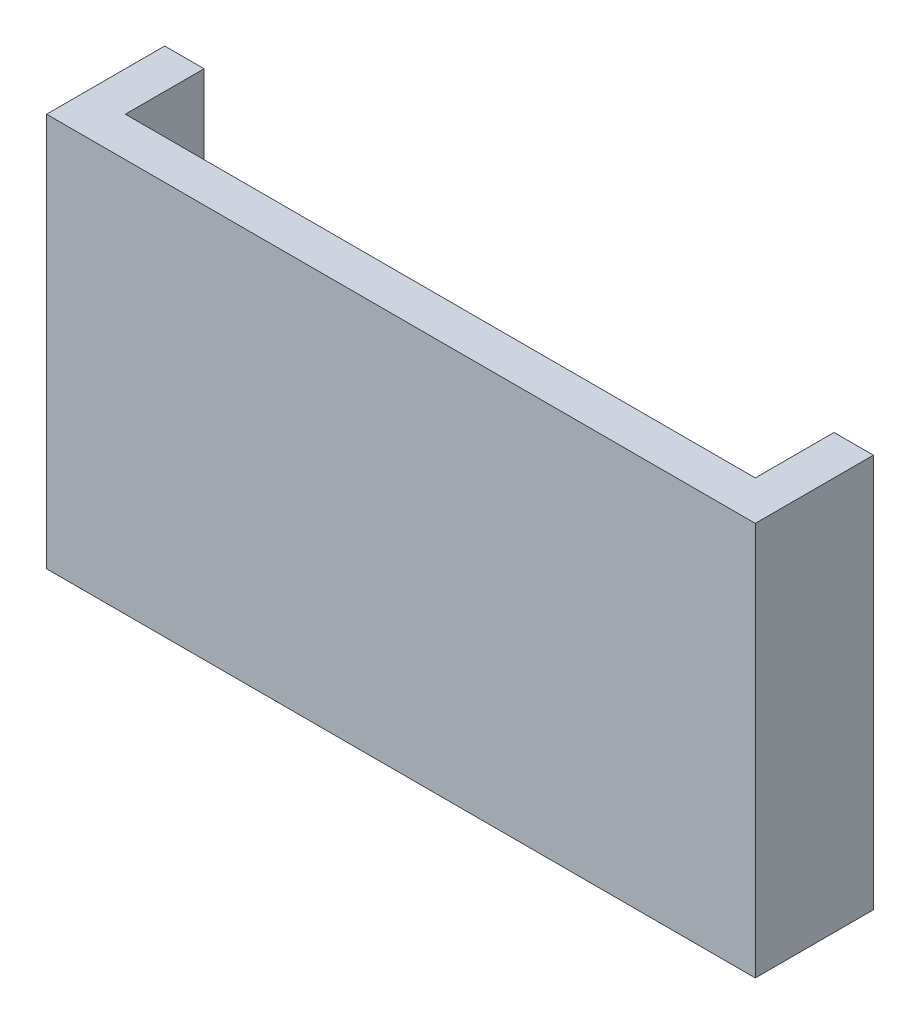
from build123d import *

# Parameters (mm, degrees)
SKETCH1_W           = 15
SKETCH1_H           = 1
BOSS_EXTRUDE1_DEPTH = 7
BOSS_EXTRUDE2_DEPTH = 1
BOSS_EXTRUDE4_DEPTH = 10


with BuildPart() as part:
    # Sketch1 → Boss-Extrude1 (new body)
    with BuildSketch(Plane(origin=(0, 0, 0), x_dir=(1, 0, 0), z_dir=(0, 1, 0))):
        with Locations((-9.5, 2.5)):
            Rectangle(SKETCH1_W, SKETCH1_H)
    extrude(amount=BOSS_EXTRUDE1_DEPTH)

    # Sketch1<3> → Boss-Extrude2 (add)
    with BuildSketch(Plane(origin=(0, 0, 0), x_dir=(1, 0, 0), z_dir=(0, 1, 0))):
        Polygon((-17, 1), (-1, 1), (-1, 3), (-2, 3), (-2, 2), (-17, 2), align=None)
    extrude(amount=BOSS_EXTRUDE2_DEPTH)

    # Sketch1<5> → Boss-Extrude4 (add)
    with BuildSketch(Plane(origin=(0, 0, 0), x_dir=(1, 0, 0), z_dir=(0, 1, 0))):
        Polygon((0, 0), (0, 3), (-1, 3), (-1, 1), (-17, 1), (-17, 3), (-18, 3), (-18, 0), align=None)
    extrude(amount=BOSS_EXTRUDE4_DEPTH)


solid = part.part
